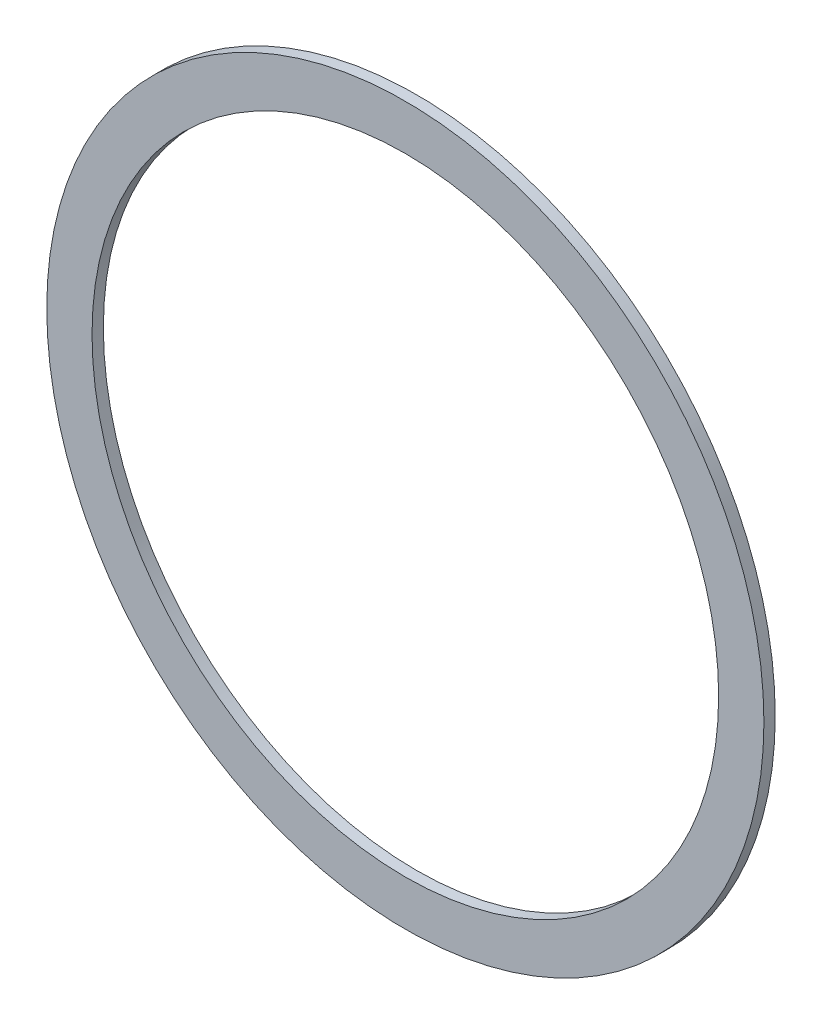
from build123d import *

# Parameters (mm, degrees)
BOSS_EXTRUDE1_DEPTH = 3.175


with BuildPart() as part:
    # Sketch2 → Boss-Extrude1 (new body)
    with BuildSketch(Plane.XY):
        with BuildLine():
            ThreePointArc((-1.783927604, 106.664181958), (-86.289926541, 57.796410124), (-89.548347912, -39.767444199))
            ThreePointArc((-89.548347912, -39.767444199), (-89.139366423, -40.557656379), (-88.723411943, -41.344220438))
            ThreePointArc((-88.723411943, -41.344220438), (-88.300763494, -42.126623343), (-87.87121564, -42.905259753))
            ThreePointArc((-87.87121564, -42.905259753), (0, -94.523651503), (87.87121564, -42.905259753))
            ThreePointArc((87.87121564, -42.905259753), (88.300763494, -42.126623343), (88.723411943, -41.344220438))
            ThreePointArc((88.723411943, -41.344220438), (89.139366423, -40.557656379), (89.548347912, -39.767444199))
            ThreePointArc((89.548347912, -39.767444199), (86.289926541, 57.796410124), (1.783927604, 106.664181958))
            ThreePointArc((1.783927604, 106.664181958), (0.891998866, 106.676045412), (0, 106.68))
            ThreePointArc((0, 106.68), (-0.891998866, 106.676045412), (-1.783927604, 106.664181958))
        make_face()
        with BuildLine():
            ThreePointArc((-7.652045127, 93.646303016), (0, -81.823651503), (7.652045127, 93.646303016))
            ThreePointArc((7.652045127, 93.646303016), (4.717664566, 93.853310885), (1.778000524, 93.962016248))
            ThreePointArc((1.778000524, 93.962016248), (0.889045735, 93.975503947), (0, 93.98))
            ThreePointArc((0, 93.98), (-0.889045735, 93.975503947), (-1.778000524, 93.962016248))
            ThreePointArc((-1.778000524, 93.962016248), (-4.717664566, 93.853310885), (-7.652045127, 93.646303016))
        make_face(mode=Mode.SUBTRACT)
    extrude(amount=-BOSS_EXTRUDE1_DEPTH)


solid = part.part
